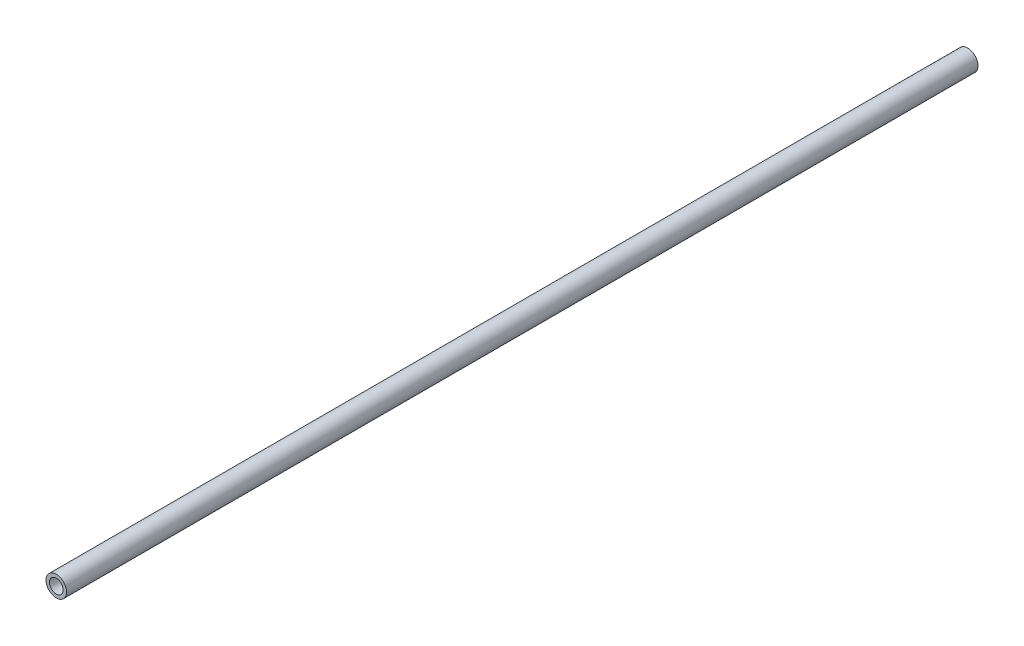
from build123d import *

# Parameters (mm, degrees)
SKETCH_1_R      = 3
SKETCH_1_R_2    = 2
EXTRUDE_1_DEPTH = 266


with BuildPart() as part:
    # 草图1 → 拉伸-薄壁1 (new body)
    with BuildSketch(Plane.XY):
        Circle(SKETCH_1_R)
        Circle(SKETCH_1_R_2, mode=Mode.SUBTRACT)
    extrude(amount=EXTRUDE_1_DEPTH)


solid = part.part
